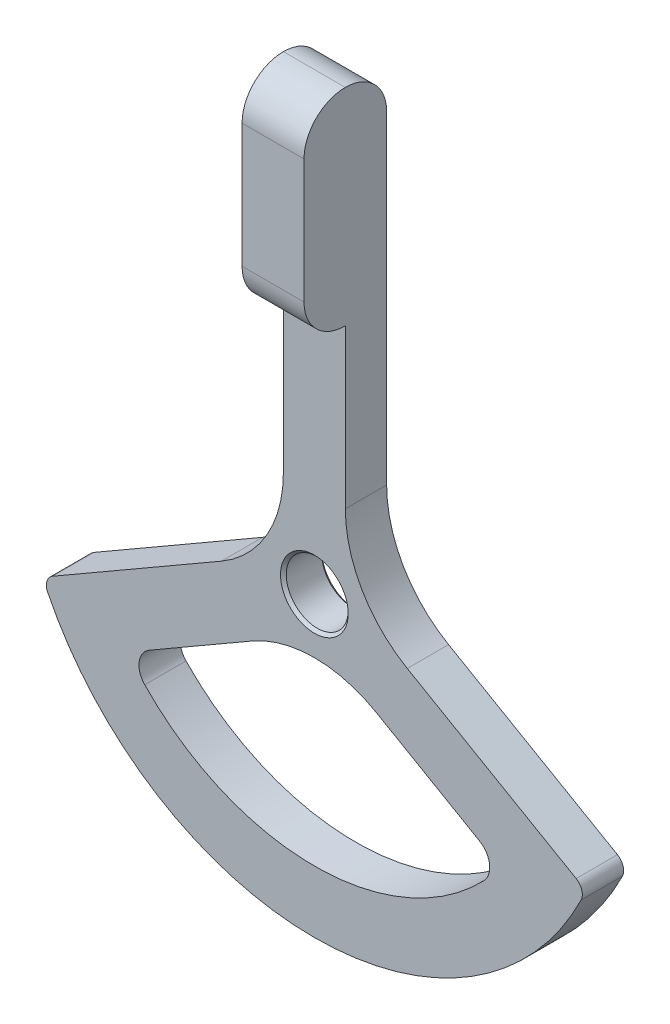
from build123d import *

# Parameters (mm, degrees)
EXTRUDE_1_DEPTH     = 5
FILLET_1_R          = 30
FILLET_2_R          = 5
SKETCH_9_W          = 10
SKETCH_9_H          = 50
EXTRUDE_3_DEPTH     = 15
FILLET_4_R          = 10
CUT_EXTRUDE_1_REACH = 130.55
SKETCH_10_R         = 7.5
CHAMFER_1_SIZE      = 0.7
FILLET_5_R          = 3


with BuildPart() as part:
    # 스케치2 → 보스-돌출1 (new, symmetric)
    with BuildSketch(Plane.XY):
        with BuildLine():
            Line((-65.764615213, -29.308964258), (-7.5, 4.330127019))
            Line((-7.5, 4.330127019), (-7.5, 110))
            Line((-7.5, 110), (0, 110))
            Line((0, 110), (7.5, 110))
            Line((7.5, 110), (7.5, 4.330127019))
            Line((7.5, 4.330127019), (65.764615213, -29.308964258))
            ThreePointArc((65.764615213, -29.308964258), (0, -72), (-65.764615213, -29.308964258))
        make_face()
        with BuildLine():
            Line((45.184267135, -34.747402831), (0, -8.660254038))
            Line((0, -8.660254038), (-45.184267135, -34.747402831))
            ThreePointArc((-45.184267135, -34.747402831), (0, -57), (45.184267135, -34.747402831))
        make_face(mode=Mode.SUBTRACT)
    extrude(amount=EXTRUDE_1_DEPTH, both=True)

    # 필렛1
    fillet_1_edges = [part.edges().sort_by_distance(p)[0] for p in [
        (-7.5, 4.330127019, 0),
        (7.5, 4.330127019, 0),
        (0, -8.660254038, 0),
    ]]
    fillet(fillet_1_edges, radius=FILLET_1_R)

    # 필렛2
    fillet_2_edges = [part.edges().sort_by_distance(p)[0] for p in [
        (-45.184267135, -34.747402831, 0),
        (45.184267135, -34.747402831, 0),
    ]]
    fillet(fillet_2_edges, radius=FILLET_2_R)

    # 스케치9 → 보스-돌출3 (add)
    with BuildSketch(Plane(origin=(7.5, 0, 0), x_dir=(0, 0, -1), z_dir=(1, 0, 0))):
        with Locations((-10, 85)):
            Rectangle(SKETCH_9_W, SKETCH_9_H)
    extrude(amount=-EXTRUDE_3_DEPTH)

    # 필렛4
    fillet_4_edges = [part.edges().sort_by_distance(p)[0] for p in [
        (0, 110, -5),
        (0, 110, 15),
        (0, 60, 15),
    ]]
    fillet(fillet_4_edges, radius=FILLET_4_R - 0.0001)  # a hair under: the kernel refuses the full size

    # 스케치10 → 컷-돌출1 (cut, up to next)
    with BuildSketch(Plane.XY.offset(5), mode=Mode.PRIVATE) as cut_extrude_1_sk1:
        Circle(SKETCH_10_R)
    cut_extrude_1_tool1 = extrude(cut_extrude_1_sk1.sketch, amount=-CUT_EXTRUDE_1_REACH, mode=Mode.PRIVATE) & part.part
    add(cut_extrude_1_tool1.solids().sort_by_distance((0, 0, 5))[0], mode=Mode.SUBTRACT)

    # 모따기1
    chamfer_1_edges = [part.edges().sort_by_distance(p)[0] for p in [
        (-7.5, 0, 5),
        (-7.5, 0, -5),
    ]]
    chamfer(chamfer_1_edges, length=CHAMFER_1_SIZE)

    # 필렛5
    fillet_5_edges = [part.edges().sort_by_distance(p)[0] for p in [
        (-65.764615213, -29.308964258, 0),
        (65.764615213, -29.308964258, 0),
    ]]
    fillet(fillet_5_edges, radius=FILLET_5_R)


solid = part.part
